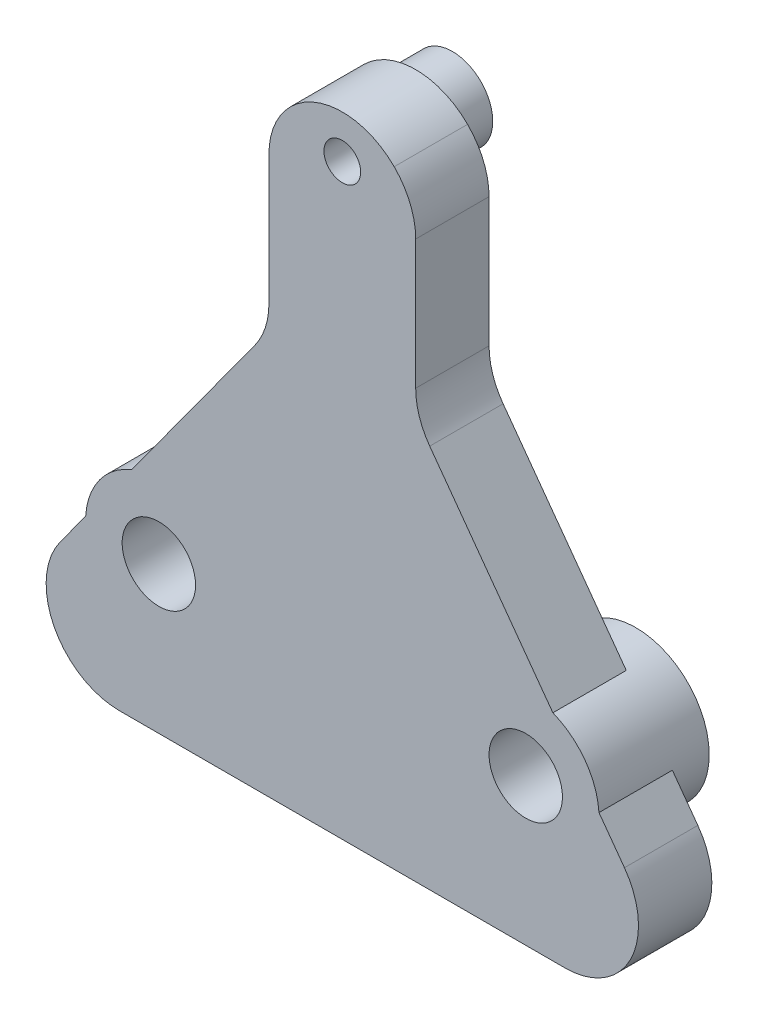
from build123d import *

# Parameters (mm, degrees)
SKETCH_1_R      = 1
SKETCH_1_R_2    = 0.5
EXTRUDE_1_DEPTH = 2
FILLET_1_R      = 2
FILLET_2_R      = 2
EXTRUDE_START   = -3
SKETCH_3_R      = 1.1
SKETCH_3_R_2    = 0.5
SKETCH_3_R_3    = 2
SKETCH_3_R_4    = 1
EXTRUDE_3_DEPTH = 3


with BuildPart() as part:
    # 草图1 → 凸台-拉伸1 (new body)
    with BuildSketch(Plane.XY):
        Polygon((-10, -4), (10, -4), (2, 7), (2, 12), (0, 14), (-2, 12), (-2, 7), align=None)
        with Locations((-5, 0)):
            Circle(SKETCH_1_R, mode=Mode.SUBTRACT)
        with Locations((5, 0)):
            Circle(SKETCH_1_R, mode=Mode.SUBTRACT)
        with Locations((0, 12)):
            Circle(SKETCH_1_R_2, mode=Mode.SUBTRACT)
    extrude(amount=EXTRUDE_1_DEPTH)

    # 圆角1
    fillet_1_edges = [part.edges().sort_by_distance(p)[0] for p in [
        (0, 14, 1),
        (2, 12, 1),
        (-2, 12, 1),
        (-2, 7, 1),
        (2, 7, 1),
    ]]
    fillet(fillet_1_edges, radius=FILLET_1_R - 0.0001)  # a hair under: the kernel refuses the full size

    # 圆角2
    fillet_2_edges = [part.edges().sort_by_distance(p)[0] for p in [
        (10, -4, 1),
        (-10, -4, 1),
    ]]
    fillet(fillet_2_edges, radius=FILLET_2_R)

    # 草图3 → 凸台-拉伸3 (add)
    # profile 1 of 3: a face of its own
    with BuildSketch(Plane.XY.offset(2).offset(EXTRUDE_START)):
        with Locations((0, 12)):
            Circle(SKETCH_3_R)
        with Locations((0, 12)):
            Circle(SKETCH_3_R_2, mode=Mode.SUBTRACT)
    # profile 2 of 3: a face of its own
    with BuildSketch(Plane.XY.offset(2).offset(EXTRUDE_START)):
        with Locations((-5, 0)):
            Circle(SKETCH_3_R_3)
        with Locations((-5, 0)):
            Circle(SKETCH_3_R_4, mode=Mode.SUBTRACT)
    # profile 3 of 3: a face of its own
    with BuildSketch(Plane.XY.offset(2).offset(EXTRUDE_START)):
        with Locations((5, 0)):
            Circle(SKETCH_3_R_3)
        with Locations((5, 0)):
            Circle(SKETCH_3_R_4, mode=Mode.SUBTRACT)
    extrude(amount=EXTRUDE_3_DEPTH)


solid = part.part
